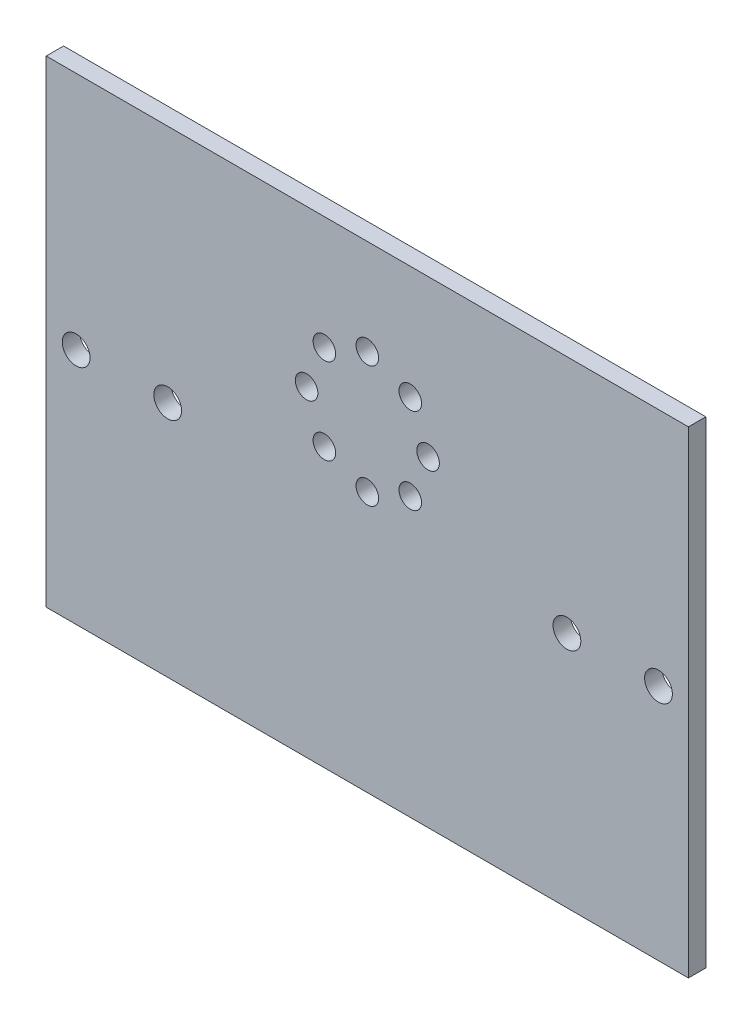
from build123d import *

# Parameters (mm, degrees)
SKETCH_1_W          = 74
SKETCH_1_H          = 55
EXTRUDE_1_DEPTH     = 2
SKETCH_2_R          = 1.6
CUT_EXTRUDE_1_DEPTH = 47.143796983
SKETCH_2_3_R        = 1.3
CUT_EXTRUDE_2_DEPTH = 47.143796983


with BuildPart() as part:
    # 草圖1 → 填料-伸長1 (new body)
    with BuildSketch(Plane.XY):
        Rectangle(SKETCH_1_W, SKETCH_1_H)
    extrude(amount=EXTRUDE_1_DEPTH)

    # 草圖2 → 除料-伸長1 (cut, through all)
    with BuildSketch(Plane.XY.offset(2)):
        with Locations((-33.55, -0.1)):
            Circle(SKETCH_2_R)
        with Locations((33.55, -0.1)):
            Circle(SKETCH_2_R)
        with Locations((-23, -0.1)):
            Circle(SKETCH_2_R)
        with Locations((23, -0.1)):
            Circle(SKETCH_2_R)
    extrude(amount=-CUT_EXTRUDE_1_DEPTH, mode=Mode.SUBTRACT)

    # 草圖2<3> → 除料-伸長2 (cut, through all)
    with BuildSketch(Plane.XY.offset(2)):
        with Locations((0, 2.5)):
            Circle(SKETCH_2_3_R)
        with Locations((-4.949747468, 4.550252532)):
            Circle(SKETCH_2_3_R)
        with Locations((-7, 9.5)):
            Circle(SKETCH_2_3_R)
        with Locations((-4.949747468, 14.449747468)):
            Circle(SKETCH_2_3_R)
        with Locations((0, 16.5)):
            Circle(SKETCH_2_3_R)
        with Locations((4.949747468, 14.449747468)):
            Circle(SKETCH_2_3_R)
        with Locations((7, 9.5)):
            Circle(SKETCH_2_3_R)
        with Locations((4.949747468, 4.550252532)):
            Circle(SKETCH_2_3_R)
    extrude(amount=-CUT_EXTRUDE_2_DEPTH, mode=Mode.SUBTRACT)


solid = part.part
